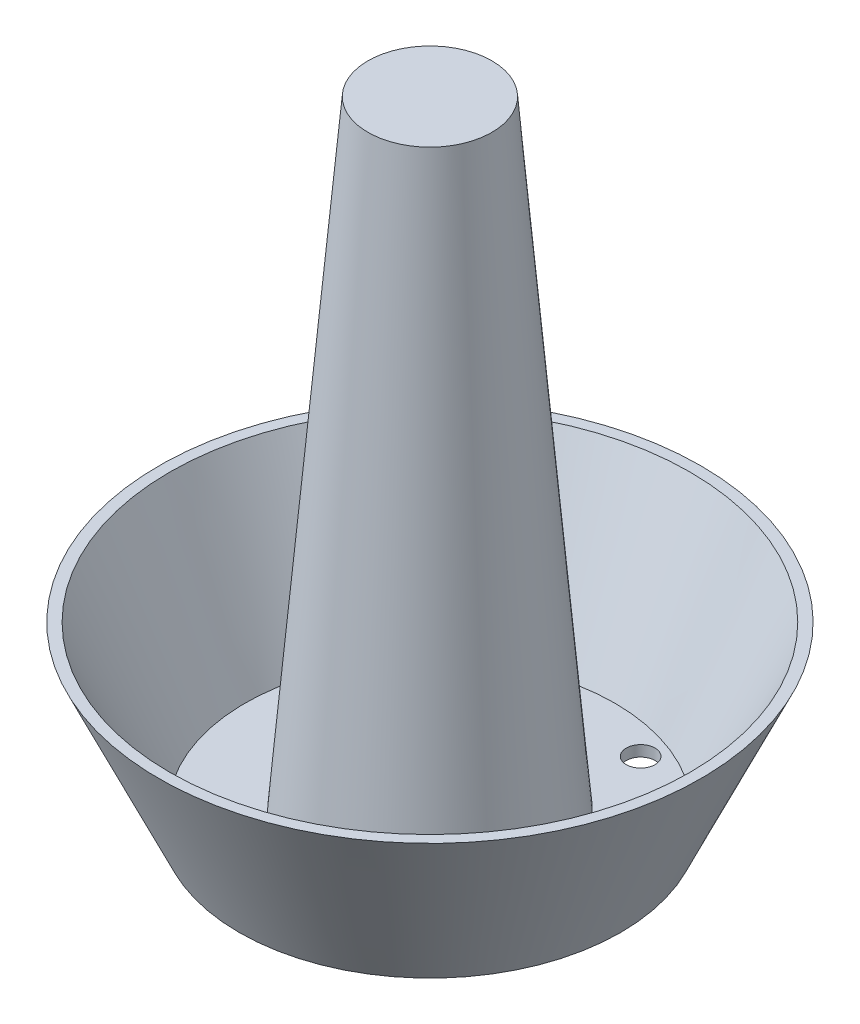
from build123d import *

# Parameters (mm, degrees)
F_5_16_CLEARANCE_HOLE1_D = 8.4328
SKETCH2_R                = 5.461
RF_CONNECTOR_DEPTH       = 12.7
SKETCH7_R                = 4.318
BOSS_EXTRUDE1_DEPTH      = 4.572


with BuildPart() as part:
    # Sketch1 → Revolve1 (revolve)
    with BuildSketch(Plane.XY):
        Polygon((0, 184.15), (18.161, 184.15), (33.655, 3.175), (54.1734375, 3.175), (76.2, 50.8), (79.375, 50.8), (55.88, 0), (0, 0), align=None)
    revolve(axis=Axis((0, 0, 0), (0, 1, 0)))

    # 5/16 Clearance Hole1 (through all)
    with Locations(Plane(origin=(0, 0, 0), x_dir=(-1, 0, 0), z_dir=(0, -1, 0))):
        with Locations((17.272, -44.45), (-17.272, -44.45)):
            f_5_16_clearance_hole1 = Hole(F_5_16_CLEARANCE_HOLE1_D / 2)

    # Sketch2 → RF Connector (add)
    with BuildSketch(Plane.XZ):
        with Locations((-14.986, 0)):
            Circle(SKETCH2_R)
    extrude(amount=RF_CONNECTOR_DEPTH)

    # Mirror1: 5/16 Clearance Hole1 across plane
    add(f_5_16_clearance_hole1.mirror(Plane.XY), mode=Mode.SUBTRACT)

    # Sketch7 → Boss-Extrude1 (add)
    with BuildSketch(Plane.XZ):
        with Locations((-19.558, -19.558)):
            Circle(SKETCH7_R)
        Circle(SKETCH7_R)
        with Locations((-19.558, 19.558)):
            Circle(SKETCH7_R)
        with Locations((19.558, 19.558)):
            Circle(SKETCH7_R)
        with Locations((19.558, -19.558)):
            Circle(SKETCH7_R)
    extrude(amount=BOSS_EXTRUDE1_DEPTH)


solid = part.part
